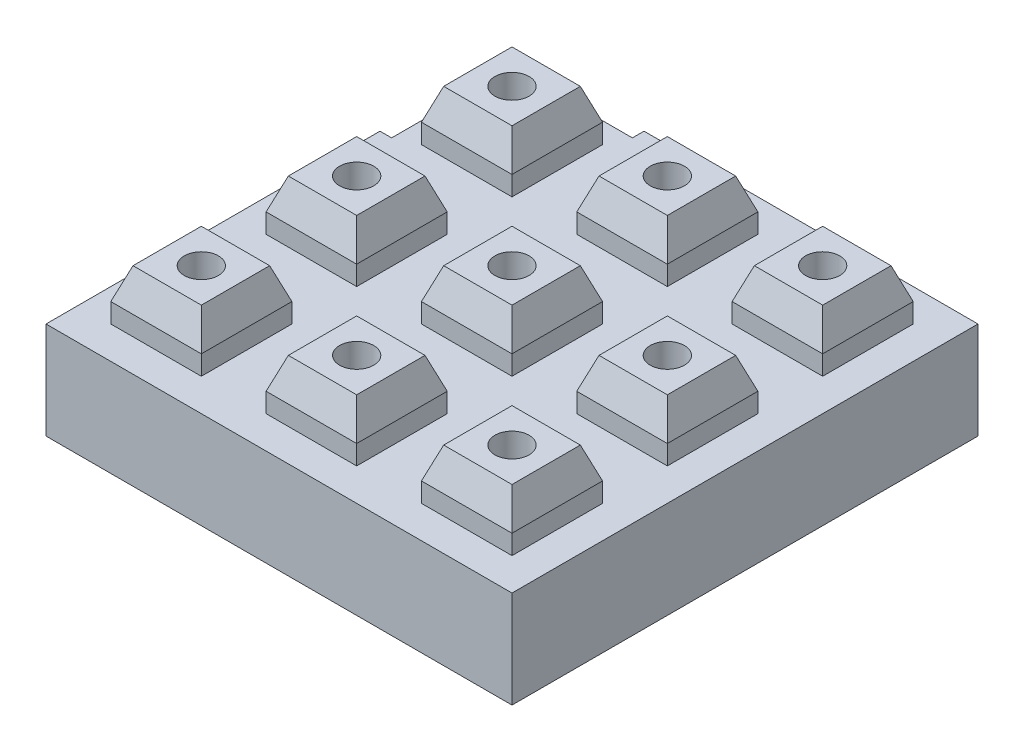
from build123d import *

# Parameters (mm, degrees)
SKETCH1_W                   = 76.2
SKETCH1_H                   = 76.2
BOSS_EXTRUDE1_DEPTH         = 12.7
SKETCH2_R                   = 1.7526
CUT_EXTRUDE1_DEPTH          = 60.56828015
SKETCH3_W                   = 76.2
SKETCH3_H                   = 76.2
SKETCH3_W_2                 = 17.78
SKETCH3_H_2                 = 17.78
CUT_EXTRUDE2_DEPTH          = 6.35
SKETCH3_2_W                 = 17.78
SKETCH3_2_H                 = 17.78
SKETCH3_2_R                 = 1.7526
CUT_EXTRUDE3_DEPTH          = 1.27
CUT_EXTRUDE4_DEPTH          = 6.35
ADVANCEDHOLE1_OUTLINE_R     = 1.89865
ADVANCEDHOLE1_OUTLINE_R_2   = 1.7526
ADVANCEDHOLE1_DEPTH         = 1.891953401
ADVANCEDHOLE1_DRAFT         = 41
ADVANCEDHOLE1_2_OUTLINE_R   = 1.89865
ADVANCEDHOLE1_2_OUTLINE_R_2 = 1.7526
ADVANCEDHOLE1_2_DEPTH       = 1.891953401
ADVANCEDHOLE1_2_DRAFT       = 41
ADVANCEDHOLE1_3_OUTLINE_R   = 1.89865
ADVANCEDHOLE1_3_OUTLINE_R_2 = 1.7526
ADVANCEDHOLE1_3_DEPTH       = 1.891953401
ADVANCEDHOLE1_3_DRAFT       = 41
ADVANCEDHOLE1_4_OUTLINE_R   = 1.89865
ADVANCEDHOLE1_4_OUTLINE_R_2 = 1.7526
ADVANCEDHOLE1_4_DEPTH       = 1.891953401
ADVANCEDHOLE1_4_DRAFT       = 41
ADVANCEDHOLE1_5_OUTLINE_R   = 1.89865
ADVANCEDHOLE1_5_OUTLINE_R_2 = 1.7526
ADVANCEDHOLE1_5_DEPTH       = 1.891953401
ADVANCEDHOLE1_5_DRAFT       = 41
ADVANCEDHOLE1_6_OUTLINE_R   = 1.89865
ADVANCEDHOLE1_6_OUTLINE_R_2 = 1.7526
ADVANCEDHOLE1_6_DEPTH       = 1.891953401
ADVANCEDHOLE1_6_DRAFT       = 41
ADVANCEDHOLE1_7_OUTLINE_R   = 1.89865
ADVANCEDHOLE1_7_OUTLINE_R_2 = 1.7526
ADVANCEDHOLE1_7_DEPTH       = 1.891953401
ADVANCEDHOLE1_7_DRAFT       = 41
ADVANCEDHOLE1_8_OUTLINE_R   = 1.89865
ADVANCEDHOLE1_8_OUTLINE_R_2 = 1.7526
ADVANCEDHOLE1_8_DEPTH       = 1.891953401
ADVANCEDHOLE1_8_DRAFT       = 41
ADVANCEDHOLE1_9_OUTLINE_R   = 1.89865
ADVANCEDHOLE1_9_OUTLINE_R_2 = 1.7526
ADVANCEDHOLE1_9_DEPTH       = 1.891953401
ADVANCEDHOLE1_9_DRAFT       = 41
CUT_EXTRUDE9_DEPTH          = 56.358016583
CUT_EXTRUDE9_DEPTH_BACK     = 56.358016583
CUT_EXTRUDE10_DEPTH         = 56.358016583
CUT_EXTRUDE10_DEPTH_BACK    = 56.358016583
SKETCH13_W                  = 14.81
SKETCH13_H                  = 14.81
CUT_EXTRUDE11_DEPTH         = 3.175
SKETCH14_R                  = 2.794
CUT_EXTRUDE12_DEPTH         = 7.62


# Read off the part's stored shape, not the designer's step: AdvancedHole1
with BuildPart() as part:
    # Sketch1 → Boss-Extrude1 (new, symmetric)
    with BuildSketch(Plane(origin=(0, 0, 0), x_dir=(1, 0, 0), z_dir=(0, 1, 0))):
        Rectangle(SKETCH1_W, SKETCH1_H)
    extrude(amount=BOSS_EXTRUDE1_DEPTH, both=True)

    # Sketch2 → Cut-Extrude1 (cut, through all)
    with BuildSketch(Plane(origin=(0, 12.7, 0), x_dir=(1, 0, 0), z_dir=(0, 1, 0))):
        with Locations(Location((-25.4, 25.4, 0), (0, 0, 270))):
            Circle(SKETCH2_R)
        with Locations(Location((0, 25.4, 0), (0, 0, 270))):
            Circle(SKETCH2_R)
        with Locations(Location((25.4, 25.4, 0), (0, 0, 270))):
            Circle(SKETCH2_R)
        with Locations(Location((0, 0, 0), (0, 0, 270))):
            Circle(SKETCH2_R)
        with Locations(Location((25.4, 0, 0), (0, 0, 270))):
            Circle(SKETCH2_R)
        with Locations(Location((0, -25.4, 0), (0, 0, 270))):
            Circle(SKETCH2_R)
        with Locations(Location((25.4, -25.4, 0), (0, 0, 270))):
            Circle(SKETCH2_R)
        with Locations(Location((-25.4, 0, 0), (0, 0, 270))):
            Circle(SKETCH2_R)
        with Locations(Location((-25.4, -25.4, 0), (0, 0, 270))):
            Circle(SKETCH2_R)
    extrude(amount=-CUT_EXTRUDE1_DEPTH, mode=Mode.SUBTRACT)

    # Sketch3 → Cut-Extrude2 (cut)
    with BuildSketch(Plane(origin=(0, 12.7, 0), x_dir=(1, 0, 0), z_dir=(0, 1, 0))):
        Rectangle(SKETCH3_W, SKETCH3_H)
        with Locations((0, 25.4)):
            Rectangle(SKETCH3_W_2, SKETCH3_H_2, mode=Mode.SUBTRACT)
        with Locations((-25.4, 25.4)):
            Rectangle(SKETCH3_W_2, SKETCH3_H_2, mode=Mode.SUBTRACT)
        with Locations((25.4, 25.4)):
            Rectangle(SKETCH3_W_2, SKETCH3_H_2, mode=Mode.SUBTRACT)
        Rectangle(SKETCH3_W_2, SKETCH3_H_2, mode=Mode.SUBTRACT)
        with Locations((25.4, 0)):
            Rectangle(SKETCH3_W_2, SKETCH3_H_2, mode=Mode.SUBTRACT)
        with Locations((0, -25.4)):
            Rectangle(SKETCH3_W_2, SKETCH3_H_2, mode=Mode.SUBTRACT)
        with Locations((25.4, -25.4)):
            Rectangle(SKETCH3_W_2, SKETCH3_H_2, mode=Mode.SUBTRACT)
        with Locations((-25.4, 0)):
            Rectangle(SKETCH3_W_2, SKETCH3_H_2, mode=Mode.SUBTRACT)
        with Locations((-25.4, -25.4)):
            Rectangle(SKETCH3_W_2, SKETCH3_H_2, mode=Mode.SUBTRACT)
    extrude(amount=-CUT_EXTRUDE2_DEPTH, mode=Mode.SUBTRACT)

    # Sketch3<2> → Cut-Extrude3 (cut)
    # profile 1 of 9: a face of its own
    with BuildSketch(Plane(origin=(0, 12.7, 0), x_dir=(1, 0, 0), z_dir=(0, 1, 0))):
        with Locations((-25.4, -25.4)):
            Rectangle(SKETCH3_2_W, SKETCH3_2_H)
        with Locations(Location((-25.4, -25.4, 0), (0, 0, 270))):
            Circle(SKETCH3_2_R, mode=Mode.SUBTRACT)
    # profile 2 of 9: a face of its own
    with BuildSketch(Plane(origin=(0, 12.7, 0), x_dir=(1, 0, 0), z_dir=(0, 1, 0))):
        with Locations((-25.4, 0)):
            Rectangle(SKETCH3_2_W, SKETCH3_2_H)
        with Locations(Location((-25.4, 0, 0), (0, 0, 270))):
            Circle(SKETCH3_2_R, mode=Mode.SUBTRACT)
    # profile 3 of 9: a face of its own
    with BuildSketch(Plane(origin=(0, 12.7, 0), x_dir=(1, 0, 0), z_dir=(0, 1, 0))):
        with Locations((-25.4, 25.4)):
            Rectangle(SKETCH3_2_W, SKETCH3_2_H)
        with Locations(Location((-25.4, 25.4, 0), (0, 0, 270))):
            Circle(SKETCH3_2_R, mode=Mode.SUBTRACT)
    # profile 4 of 9: a face of its own
    with BuildSketch(Plane(origin=(0, 12.7, 0), x_dir=(1, 0, 0), z_dir=(0, 1, 0))):
        with Locations((0, 25.4)):
            Rectangle(SKETCH3_2_W, SKETCH3_2_H)
        with Locations(Location((0, 25.4, 0), (0, 0, 270))):
            Circle(SKETCH3_2_R, mode=Mode.SUBTRACT)
    # profile 5 of 9: a face of its own
    with BuildSketch(Plane(origin=(0, 12.7, 0), x_dir=(1, 0, 0), z_dir=(0, 1, 0))):
        Rectangle(SKETCH3_2_W, SKETCH3_2_H)
        with Locations(Location((0, 0, 0), (0, 0, 270))):
            Circle(SKETCH3_2_R, mode=Mode.SUBTRACT)
    # profile 6 of 9: a face of its own
    with BuildSketch(Plane(origin=(0, 12.7, 0), x_dir=(1, 0, 0), z_dir=(0, 1, 0))):
        with Locations((0, -25.4)):
            Rectangle(SKETCH3_2_W, SKETCH3_2_H)
        with Locations(Location((0, -25.4, 0), (0, 0, 270))):
            Circle(SKETCH3_2_R, mode=Mode.SUBTRACT)
    # profile 7 of 9: a face of its own
    with BuildSketch(Plane(origin=(0, 12.7, 0), x_dir=(1, 0, 0), z_dir=(0, 1, 0))):
        with Locations((25.4, -25.4)):
            Rectangle(SKETCH3_2_W, SKETCH3_2_H)
        with Locations(Location((25.4, -25.4, 0), (0, 0, 270))):
            Circle(SKETCH3_2_R, mode=Mode.SUBTRACT)
    # profile 8 of 9: a face of its own
    with BuildSketch(Plane(origin=(0, 12.7, 0), x_dir=(1, 0, 0), z_dir=(0, 1, 0))):
        with Locations((25.4, 0)):
            Rectangle(SKETCH3_2_W, SKETCH3_2_H)
        with Locations(Location((25.4, 0, 0), (0, 0, 270))):
            Circle(SKETCH3_2_R, mode=Mode.SUBTRACT)
    # profile 9 of 9: a face of its own
    with BuildSketch(Plane(origin=(0, 12.7, 0), x_dir=(1, 0, 0), z_dir=(0, 1, 0))):
        with Locations((25.4, 25.4)):
            Rectangle(SKETCH3_2_W, SKETCH3_2_H)
        with Locations(Location((25.4, 25.4, 0), (0, 0, 270))):
            Circle(SKETCH3_2_R, mode=Mode.SUBTRACT)
    extrude(amount=-CUT_EXTRUDE3_DEPTH, mode=Mode.SUBTRACT)

    # Sketch4 → Cut-Extrude4 (cut)
    with BuildSketch(Plane(origin=(0, 6.35, 0), x_dir=(1, 0, 0), z_dir=(0, 1, 0))):
        Polygon((-38.1, 38.1), (-38.1, 16.51), (-36.195, 16.51), (-36.195, 36.195), (-16.51, 36.195), (-16.51, 38.1), align=None)
    extrude(amount=-CUT_EXTRUDE4_DEPTH, mode=Mode.SUBTRACT)


with BuildPart() as advancedhole1_tool:
    # AdvancedHole1 outline → AdvancedHole1 (with draft: the straight prism first)
    with BuildSketch(Plane(origin=(0, -10.808046599, 0), x_dir=(1, 0, 0), z_dir=(0, 1, 0))):
        with Locations((25.4, 0)):
            Circle(ADVANCEDHOLE1_OUTLINE_R)
        with Locations((25.4, 0)):
            Circle(ADVANCEDHOLE1_OUTLINE_R_2, mode=Mode.SUBTRACT)
    extrude(amount=-ADVANCEDHOLE1_DEPTH)
    # AdvancedHole1: the draft: its side faces are tilted about the plane it starts from
    advancedhole1_sides = [advancedhole1_tool.faces().sort_by_distance(p)[0] for p in [
        (23.50135, -11.7540233, 0),
        (23.6474, -11.7540233, 0),
    ]]
    draft(advancedhole1_sides, Plane(origin=(0, -10.808046599, 0), x_dir=(1, 0, 0), z_dir=(0, 1, 0)), ADVANCEDHOLE1_DRAFT)


with BuildPart() as part_1:
    add(part.part)

    # AdvancedHole1: cut by advancedhole1_tool
    add(advancedhole1_tool.part, mode=Mode.SUBTRACT)


with BuildPart() as advancedhole1_2_tool:
    # AdvancedHole1 2 outline → AdvancedHole1 2 (with draft: the straight prism first)
    with BuildSketch(Plane(origin=(0, -10.808046599, 0), x_dir=(1, 0, 0), z_dir=(0, 1, 0))):
        with Locations((25.4, -25.4)):
            Circle(ADVANCEDHOLE1_2_OUTLINE_R)
        with Locations((25.4, -25.4)):
            Circle(ADVANCEDHOLE1_2_OUTLINE_R_2, mode=Mode.SUBTRACT)
    extrude(amount=-ADVANCEDHOLE1_2_DEPTH)
    # AdvancedHole1 2: the draft: its side faces are tilted about the plane it starts from
    advancedhole1_2_sides = [advancedhole1_2_tool.faces().sort_by_distance(p)[0] for p in [
        (23.50135, -11.7540233, 25.4),
        (23.6474, -11.7540233, 25.4),
    ]]
    draft(advancedhole1_2_sides, Plane(origin=(0, -10.808046599, 0), x_dir=(1, 0, 0), z_dir=(0, 1, 0)), ADVANCEDHOLE1_2_DRAFT)


with BuildPart() as part_2:
    add(part_1.part)

    # AdvancedHole1 2: cut by advancedhole1_2_tool
    add(advancedhole1_2_tool.part, mode=Mode.SUBTRACT)


with BuildPart() as advancedhole1_3_tool:
    # AdvancedHole1 3 outline → AdvancedHole1 3 (with draft: the straight prism first)
    with BuildSketch(Plane(origin=(0, -10.808046599, 0), x_dir=(1, 0, 0), z_dir=(0, 1, 0))):
        with Locations((-25.4, -25.4)):
            Circle(ADVANCEDHOLE1_3_OUTLINE_R)
        with Locations((-25.4, -25.4)):
            Circle(ADVANCEDHOLE1_3_OUTLINE_R_2, mode=Mode.SUBTRACT)
    extrude(amount=-ADVANCEDHOLE1_3_DEPTH)
    # AdvancedHole1 3: the draft: its side faces are tilted about the plane it starts from
    advancedhole1_3_sides = [advancedhole1_3_tool.faces().sort_by_distance(p)[0] for p in [
        (-27.29865, -11.7540233, 25.4),
        (-27.1526, -11.7540233, 25.4),
    ]]
    draft(advancedhole1_3_sides, Plane(origin=(0, -10.808046599, 0), x_dir=(1, 0, 0), z_dir=(0, 1, 0)), ADVANCEDHOLE1_3_DRAFT)


with BuildPart() as part_3:
    add(part_2.part)

    # AdvancedHole1 3: cut by advancedhole1_3_tool
    add(advancedhole1_3_tool.part, mode=Mode.SUBTRACT)


with BuildPart() as advancedhole1_4_tool:
    # AdvancedHole1 4 outline → AdvancedHole1 4 (with draft: the straight prism first)
    with BuildSketch(Plane(origin=(0, -10.808046599, 0), x_dir=(1, 0, 0), z_dir=(0, 1, 0))):
        with Locations((0, -25.4)):
            Circle(ADVANCEDHOLE1_4_OUTLINE_R)
        with Locations((0, -25.4)):
            Circle(ADVANCEDHOLE1_4_OUTLINE_R_2, mode=Mode.SUBTRACT)
    extrude(amount=-ADVANCEDHOLE1_4_DEPTH)
    # AdvancedHole1 4: the draft: its side faces are tilted about the plane it starts from
    advancedhole1_4_sides = [advancedhole1_4_tool.faces().sort_by_distance(p)[0] for p in [
        (-1.89865, -11.7540233, 25.4),
        (-1.7526, -11.7540233, 25.4),
    ]]
    draft(advancedhole1_4_sides, Plane(origin=(0, -10.808046599, 0), x_dir=(1, 0, 0), z_dir=(0, 1, 0)), ADVANCEDHOLE1_4_DRAFT)


with BuildPart() as part_4:
    add(part_3.part)

    # AdvancedHole1 4: cut by advancedhole1_4_tool
    add(advancedhole1_4_tool.part, mode=Mode.SUBTRACT)


with BuildPart() as advancedhole1_5_tool:
    # AdvancedHole1 5 outline → AdvancedHole1 5 (with draft: the straight prism first)
    with BuildSketch(Plane(origin=(0, -10.808046599, 0), x_dir=(1, 0, 0), z_dir=(0, 1, 0))):
        with Locations((-25.4, 0)):
            Circle(ADVANCEDHOLE1_5_OUTLINE_R)
        with Locations((-25.4, 0)):
            Circle(ADVANCEDHOLE1_5_OUTLINE_R_2, mode=Mode.SUBTRACT)
    extrude(amount=-ADVANCEDHOLE1_5_DEPTH)
    # AdvancedHole1 5: the draft: its side faces are tilted about the plane it starts from
    advancedhole1_5_sides = [advancedhole1_5_tool.faces().sort_by_distance(p)[0] for p in [
        (-27.29865, -11.7540233, 0),
        (-27.1526, -11.7540233, 0),
    ]]
    draft(advancedhole1_5_sides, Plane(origin=(0, -10.808046599, 0), x_dir=(1, 0, 0), z_dir=(0, 1, 0)), ADVANCEDHOLE1_5_DRAFT)


with BuildPart() as part_5:
    add(part_4.part)

    # AdvancedHole1 5: cut by advancedhole1_5_tool
    add(advancedhole1_5_tool.part, mode=Mode.SUBTRACT)


with BuildPart() as advancedhole1_6_tool:
    # AdvancedHole1 6 outline → AdvancedHole1 6 (with draft: the straight prism first)
    with BuildSketch(Plane(origin=(0, -10.808046599, 0), x_dir=(1, 0, 0), z_dir=(0, 1, 0))):
        Circle(ADVANCEDHOLE1_6_OUTLINE_R)
        Circle(ADVANCEDHOLE1_6_OUTLINE_R_2, mode=Mode.SUBTRACT)
    extrude(amount=-ADVANCEDHOLE1_6_DEPTH)
    # AdvancedHole1 6: the draft: its side faces are tilted about the plane it starts from
    advancedhole1_6_sides = [advancedhole1_6_tool.faces().sort_by_distance(p)[0] for p in [
        (-1.89865, -11.7540233, 0),
        (-1.7526, -11.7540233, 0),
    ]]
    draft(advancedhole1_6_sides, Plane(origin=(0, -10.808046599, 0), x_dir=(1, 0, 0), z_dir=(0, 1, 0)), ADVANCEDHOLE1_6_DRAFT)


with BuildPart() as part_6:
    add(part_5.part)

    # AdvancedHole1 6: cut by advancedhole1_6_tool
    add(advancedhole1_6_tool.part, mode=Mode.SUBTRACT)


with BuildPart() as advancedhole1_7_tool:
    # AdvancedHole1 7 outline → AdvancedHole1 7 (with draft: the straight prism first)
    with BuildSketch(Plane(origin=(0, -10.808046599, 0), x_dir=(1, 0, 0), z_dir=(0, 1, 0))):
        with Locations((-25.4, 25.4)):
            Circle(ADVANCEDHOLE1_7_OUTLINE_R)
        with Locations((-25.4, 25.4)):
            Circle(ADVANCEDHOLE1_7_OUTLINE_R_2, mode=Mode.SUBTRACT)
    extrude(amount=-ADVANCEDHOLE1_7_DEPTH)
    # AdvancedHole1 7: the draft: its side faces are tilted about the plane it starts from
    advancedhole1_7_sides = [advancedhole1_7_tool.faces().sort_by_distance(p)[0] for p in [
        (-27.29865, -11.7540233, -25.4),
        (-27.1526, -11.7540233, -25.4),
    ]]
    draft(advancedhole1_7_sides, Plane(origin=(0, -10.808046599, 0), x_dir=(1, 0, 0), z_dir=(0, 1, 0)), ADVANCEDHOLE1_7_DRAFT)


with BuildPart() as part_7:
    add(part_6.part)

    # AdvancedHole1 7: cut by advancedhole1_7_tool
    add(advancedhole1_7_tool.part, mode=Mode.SUBTRACT)


with BuildPart() as advancedhole1_8_tool:
    # AdvancedHole1 8 outline → AdvancedHole1 8 (with draft: the straight prism first)
    with BuildSketch(Plane(origin=(0, -10.808046599, 0), x_dir=(1, 0, 0), z_dir=(0, 1, 0))):
        with Locations((25.4, 25.4)):
            Circle(ADVANCEDHOLE1_8_OUTLINE_R)
        with Locations((25.4, 25.4)):
            Circle(ADVANCEDHOLE1_8_OUTLINE_R_2, mode=Mode.SUBTRACT)
    extrude(amount=-ADVANCEDHOLE1_8_DEPTH)
    # AdvancedHole1 8: the draft: its side faces are tilted about the plane it starts from
    advancedhole1_8_sides = [advancedhole1_8_tool.faces().sort_by_distance(p)[0] for p in [
        (23.50135, -11.7540233, -25.4),
        (23.6474, -11.7540233, -25.4),
    ]]
    draft(advancedhole1_8_sides, Plane(origin=(0, -10.808046599, 0), x_dir=(1, 0, 0), z_dir=(0, 1, 0)), ADVANCEDHOLE1_8_DRAFT)


with BuildPart() as part_8:
    add(part_7.part)

    # AdvancedHole1 8: cut by advancedhole1_8_tool
    add(advancedhole1_8_tool.part, mode=Mode.SUBTRACT)


with BuildPart() as advancedhole1_9_tool:
    # AdvancedHole1 9 outline → AdvancedHole1 9 (with draft: the straight prism first)
    with BuildSketch(Plane(origin=(0, -10.808046599, 0), x_dir=(1, 0, 0), z_dir=(0, 1, 0))):
        with Locations((0, 25.4)):
            Circle(ADVANCEDHOLE1_9_OUTLINE_R)
        with Locations((0, 25.4)):
            Circle(ADVANCEDHOLE1_9_OUTLINE_R_2, mode=Mode.SUBTRACT)
    extrude(amount=-ADVANCEDHOLE1_9_DEPTH)
    # AdvancedHole1 9: the draft: its side faces are tilted about the plane it starts from
    advancedhole1_9_sides = [advancedhole1_9_tool.faces().sort_by_distance(p)[0] for p in [
        (-1.89865, -11.7540233, -25.4),
        (-1.7526, -11.7540233, -25.4),
    ]]
    draft(advancedhole1_9_sides, Plane(origin=(0, -10.808046599, 0), x_dir=(1, 0, 0), z_dir=(0, 1, 0)), ADVANCEDHOLE1_9_DRAFT)


with BuildPart() as part_9:
    add(part_8.part)

    # AdvancedHole1 9: cut by advancedhole1_9_tool
    add(advancedhole1_9_tool.part, mode=Mode.SUBTRACT)

    # Sketch11 → Cut-Extrude9 (cut, two sides: drawn at the far end of the back side and taken through both)
    with BuildSketch(Plane.XY.offset(-CUT_EXTRUDE9_DEPTH_BACK)):
        Polygon((-34.29, 6.35), (-34.29, 11.43), (-30.986096666, 11.43), (-32.805, 6.35), align=None)
        Polygon((-17.995, 6.35), (-16.51, 6.35), (-16.51, 11.43), (-19.813903334, 11.43), align=None)
        Polygon((7.405, 6.35), (8.89, 6.35), (8.89, 11.43), (5.586096666, 11.43), align=None)
        Polygon((-7.405, 6.35), (-8.89, 6.35), (-8.89, 11.43), (-5.586096666, 11.43), align=None)
        Polygon((32.805, 6.35), (34.29, 6.35), (34.29, 11.43), (30.986096666, 11.43), align=None)
        Polygon((17.995, 6.35), (16.51, 6.35), (16.51, 11.43), (19.813903334, 11.43), align=None)
    extrude(amount=CUT_EXTRUDE9_DEPTH + CUT_EXTRUDE9_DEPTH_BACK, mode=Mode.SUBTRACT)

    # Sketch12 → Cut-Extrude10 (cut, two sides: drawn at the far end of the back side and taken through both)
    with BuildSketch(Plane(origin=(0, 0, 0), x_dir=(0, 0, -1), z_dir=(1, 0, 0)).offset(-CUT_EXTRUDE10_DEPTH_BACK)):
        Polygon((34.29, 11.43), (30.986096666, 11.43), (32.805, 6.35), (34.29, 6.35), align=None)
        Polygon((16.51, 6.35), (16.51, 11.43), (19.813903334, 11.43), (17.995, 6.35), align=None)
        Polygon((-8.89, 6.35), (-8.89, 11.43), (-5.586096666, 11.43), (-7.405, 6.35), align=None)
        Polygon((8.89, 6.35), (8.89, 11.43), (5.586096666, 11.43), (7.405, 6.35), align=None)
        Polygon((-34.29, 6.35), (-34.29, 11.43), (-30.986096666, 11.43), (-32.805, 6.35), align=None)
        Polygon((-16.51, 6.35), (-16.51, 11.43), (-19.813903334, 11.43), (-17.995, 6.35), align=None)
    extrude(amount=CUT_EXTRUDE10_DEPTH + CUT_EXTRUDE10_DEPTH_BACK, mode=Mode.SUBTRACT)

    # Sketch13 → Cut-Extrude11 (cut)
    with BuildSketch(Plane(origin=(0, 6.35, 0), x_dir=(1, 0, 0), z_dir=(0, 1, 0))):
        Polygon((38.1, -38.1), (38.1, 38.1), (-16.51, 38.1), (-16.51, 36.195), (-36.195, 36.195), (-36.195, 16.51), (-38.1, 16.51), (-38.1, -38.1), align=None)
        with Locations((25.4, -25.4)):
            Rectangle(SKETCH13_W, SKETCH13_H, mode=Mode.SUBTRACT)
        with Locations((25.4, 0)):
            Rectangle(SKETCH13_W, SKETCH13_H, mode=Mode.SUBTRACT)
        Rectangle(SKETCH13_W, SKETCH13_H, mode=Mode.SUBTRACT)
        with Locations((0, -25.4)):
            Rectangle(SKETCH13_W, SKETCH13_H, mode=Mode.SUBTRACT)
        with Locations((-25.4, -25.4)):
            Rectangle(SKETCH13_W, SKETCH13_H, mode=Mode.SUBTRACT)
        with Locations((-25.4, 0)):
            Rectangle(SKETCH13_W, SKETCH13_H, mode=Mode.SUBTRACT)
        with Locations((-25.4, 25.4)):
            Rectangle(SKETCH13_W, SKETCH13_H, mode=Mode.SUBTRACT)
        with Locations((25.4, 25.4)):
            Rectangle(SKETCH13_W, SKETCH13_H, mode=Mode.SUBTRACT)
        with Locations((0, 25.4)):
            Rectangle(SKETCH13_W, SKETCH13_H, mode=Mode.SUBTRACT)
    extrude(amount=-CUT_EXTRUDE11_DEPTH, mode=Mode.SUBTRACT)

    # Sketch14 → Cut-Extrude12 (cut)
    with BuildSketch(Plane(origin=(0, 11.43, 0), x_dir=(1, 0, 0), z_dir=(0, 1, 0))):
        with Locations(Location((-25.4, 25.4, 0), (0, 0, 270))):
            Circle(SKETCH14_R)
        with Locations(Location((0, 25.4, 0), (0, 0, 270))):
            Circle(SKETCH14_R)
        with Locations(Location((25.4, 25.4, 0), (0, 0, 270))):
            Circle(SKETCH14_R)
        with Locations(Location((0, 0, 0), (0, 0, 270))):
            Circle(SKETCH14_R)
        with Locations(Location((25.4, 0, 0), (0, 0, 270))):
            Circle(SKETCH14_R)
        with Locations(Location((0, -25.4, 0), (0, 0, 270))):
            Circle(SKETCH14_R)
        with Locations(Location((25.4, -25.4, 0), (0, 0, 270))):
            Circle(SKETCH14_R)
        with Locations(Location((-25.4, 0, 0), (0, 0, 270))):
            Circle(SKETCH14_R)
        with Locations(Location((-25.4, -25.4, 0), (0, 0, 270))):
            Circle(SKETCH14_R)
    extrude(amount=-CUT_EXTRUDE12_DEPTH, mode=Mode.SUBTRACT)


solid = part_9.part
